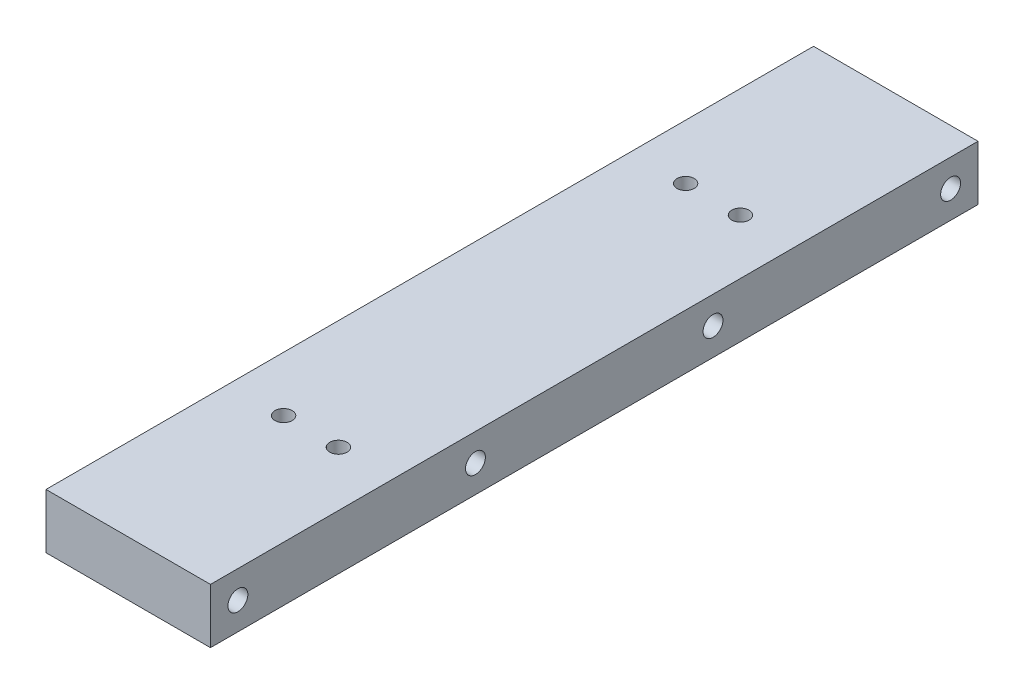
from build123d import *

# Parameters (mm, degrees)
SKETCH2_W           = 28.575
SKETCH2_H           = 133.35
BOSS_EXTRUDE1_DEPTH = 9.525
LPATTERN1_COUNT     = 4
LPATTERN1_PITCH     = 41.275
LPATTERN2_COUNT     = 4
LPATTERN2_PITCH     = 41.275
SKETCH8_R           = 1.5
CUT_EXTRUDE2_DEPTH  = 137.709468399


with BuildPart() as part:
    # Sketch2 → Boss-Extrude1 (new body)
    with BuildSketch(Plane(origin=(0, 0, 0), x_dir=(1, 0, 0), z_dir=(0, 1, 0))):
        with Locations((14.2875, 66.675)):
            Rectangle(SKETCH2_W, SKETCH2_H)
    extrude(amount=BOSS_EXTRUDE1_DEPTH)

    # Sketch5 → #5 Clearance Hole1 (revolve, cut)
    with BuildSketch(Plane(origin=(28.575, 4.7625, -4.7625), x_dir=(0, 0, -1), z_dir=(0, 1, 0))):
        Polygon((0, 0), (0, 13.737806461), (1.7272, 12.7), (1.7272, 0), align=None)
    f_5_clearance_hole1 = revolve(axis=Axis((34.925, 4.7625, -4.7625), (-1, 0, 0)), mode=Mode.SUBTRACT)

    # LPattern1: #5 Clearance Hole1 ×4
    with Locations(*[(0, 0, -i * LPATTERN1_PITCH) for i in range(1, LPATTERN1_COUNT)]):
        add(f_5_clearance_hole1, mode=Mode.SUBTRACT)

    # Sketch7 → #5 Clearance Hole2 (revolve, cut)
    with BuildSketch(Plane(origin=(0, 4.7625, -128.5875), x_dir=(0, 0, 1), z_dir=(0, 1, 0))):
        Polygon((0, 0), (0, 13.737806461), (1.7272, 12.7), (1.7272, 0), align=None)
    f_5_clearance_hole2 = revolve(axis=Axis((-6.35, 4.7625, -128.5875), (1, 0, 0)), mode=Mode.SUBTRACT)

    # LPattern2: #5 Clearance Hole2 ×4
    with Locations(*[(0, 0, i * LPATTERN2_PITCH) for i in range(1, LPATTERN2_COUNT)]):
        add(f_5_clearance_hole2, mode=Mode.SUBTRACT)

    # Sketch8 → Cut-Extrude2 (cut, through all)
    with BuildSketch(Plane.XZ):
        with Locations((9.525, -31.75)):
            Circle(SKETCH8_R)
        with Locations((9.525, -101.6)):
            Circle(SKETCH8_R)
        with Locations((19.05, -101.6)):
            Circle(SKETCH8_R)
        with Locations((19.05, -31.75)):
            Circle(SKETCH8_R)
    extrude(amount=-CUT_EXTRUDE2_DEPTH, mode=Mode.SUBTRACT)


solid = part.part
